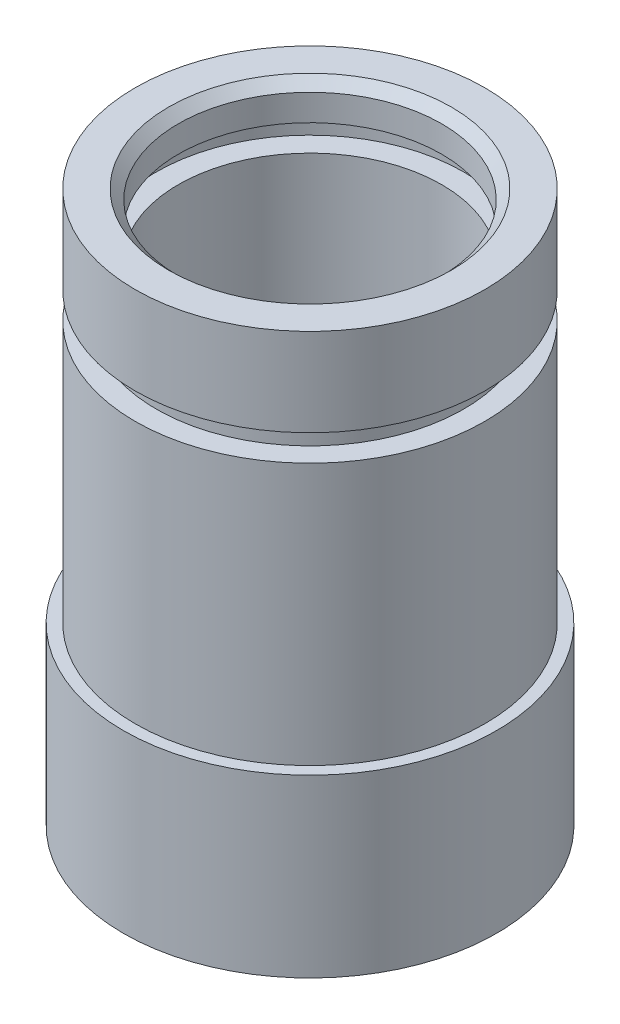
from build123d import *


with BuildPart() as part:
    # Sketch1 → Revolve1 (revolve)
    with BuildSketch(Plane.XY):
        Polygon((19.05, -36.336053449), (19.05, -70.372053449), (15.875, -70.372053449), (25.7175, -107.104763523), (26.9875, -107.104763523), (26.9875, -81.704763523), (25.2857, -81.704763523), (25.2857, -43.829053449), (22.225, -43.829053449), (22.225, -40.019053449), (25.2857, -40.019053449), (25.2857, -27.319053449), (20.447, -27.319053449), (19.05, -28.716053449), (19.05, -32.526053449), (22.225, -32.526053449), (22.225, -36.336053449), align=None)
    revolve(axis=Axis((0, 0, 0), (0, 1, 0)))


solid = part.part
